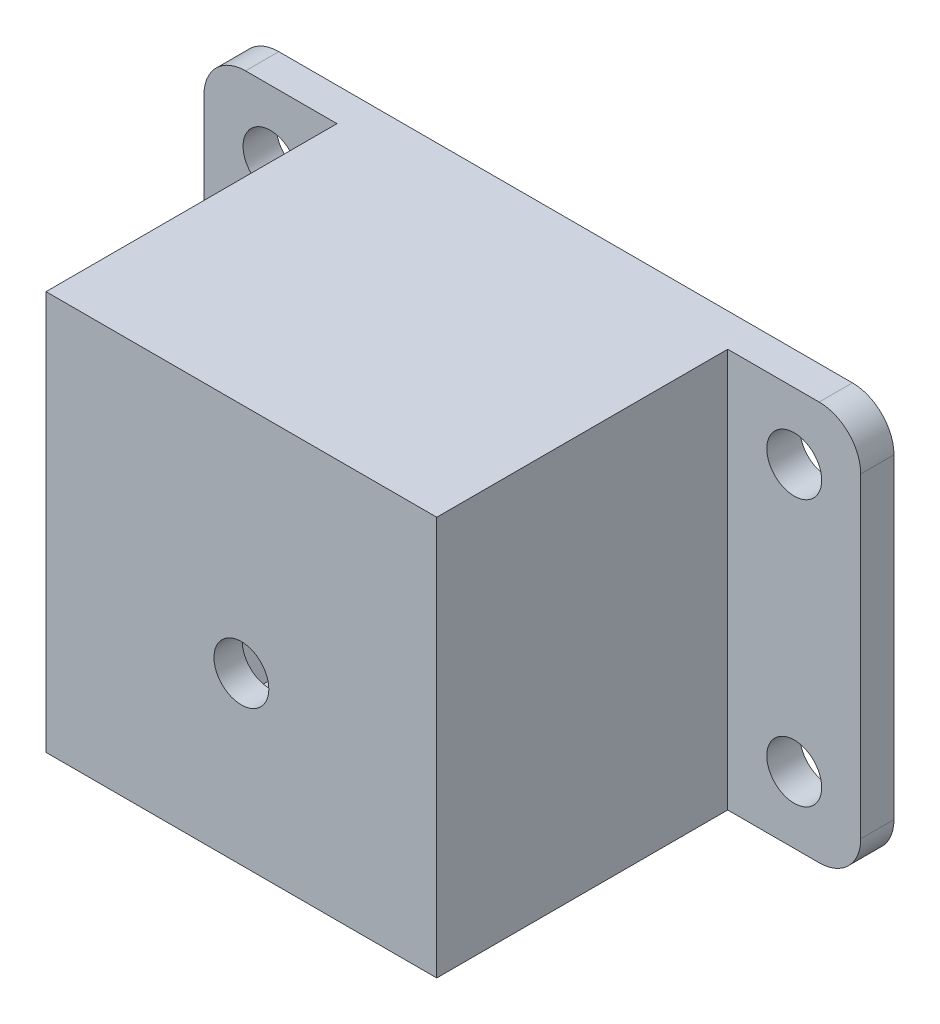
from build123d import *

# Parameters (mm, degrees)
SKETCH1_R           = 1.65
BOSS_EXTRUDE1_DEPTH = 2
BOSS_EXTRUDE2_DEPTH = 11.5
SKETCH3_W           = 23.5
SKETCH3_H           = 24
SKETCH3_R           = 1.65
BOSS_EXTRUDE3_DEPTH = 6
CUT_EXTRUDE1_START  = -1.7
CUT_EXTRUDE1_DEPTH  = 2.6
FILLET1_R           = 2.5


with BuildPart() as part:
    # Sketch1 → Boss-Extrude1 (new body)
    with BuildSketch(Plane(origin=(0, 0, 0), x_dir=(0, 1, 0), z_dir=(0, 0, 1))):
        Polygon((-24, 12), (-4, 12), (-4, 27.5), (-24, 27.5), (-24, 39.5), (0, 39.5), (0, 0), (-24, 0), align=None)
        with Locations((-20, 4)):
            Circle(SKETCH1_R, mode=Mode.SUBTRACT)
        with Locations((-4, 4)):
            Circle(SKETCH1_R, mode=Mode.SUBTRACT)
        with Locations((-4, 35.5)):
            Circle(SKETCH1_R, mode=Mode.SUBTRACT)
        with Locations((-20, 35.5)):
            Circle(SKETCH1_R, mode=Mode.SUBTRACT)
    extrude(amount=BOSS_EXTRUDE1_DEPTH)

    # Sketch2 → Boss-Extrude2 (add)
    with BuildSketch(Plane.XY.offset(2)):
        Polygon((-27.5, -24), (-27.5, -4), (-12, -4), (-12, -24), (-8, -24), (-8, 0), (-31.5, 0), (-31.5, -24), align=None)
    extrude(amount=BOSS_EXTRUDE2_DEPTH)

    # Sketch3 → Boss-Extrude3 (add)
    with BuildSketch(Plane.XY.offset(13.5)):
        with Locations((-19.75, -12)):
            Rectangle(SKETCH3_W, SKETCH3_H)
        with Locations((-19.75, -14)):
            Circle(SKETCH3_R, mode=Mode.SUBTRACT)
    extrude(amount=BOSS_EXTRUDE3_DEPTH)

    # Sketch4 → Cut-Extrude1 (cut)
    with BuildSketch(Plane.XY.offset(19.5).offset(CUT_EXTRUDE1_START)):
        Polygon((-16.401368439, -14), (-18.075684219, -11.1), (-21.424315781, -11.1), (-23.098631561, -14), (-21.424315781, -16.9), (-18.075684219, -16.9), align=None)
    extrude(amount=-CUT_EXTRUDE1_DEPTH, mode=Mode.SUBTRACT)

    # Fillet1
    fillet1_edges = [part.edges().sort_by_distance(p)[0] for p in [
        (0, -24, 1),
        (0, 0, 1),
        (-39.5, 0, 1),
        (-39.5, -24, 1),
    ]]
    fillet(fillet1_edges, radius=FILLET1_R)


solid = part.part
